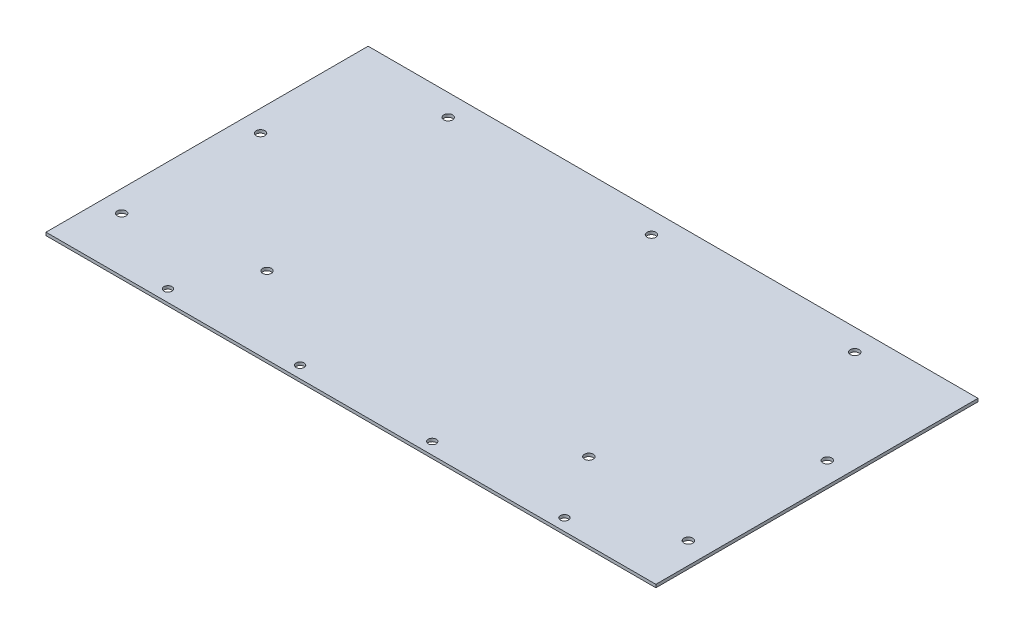
from build123d import *

# Parameters (mm, degrees)
SKETCH1_W            = 457.2
SKETCH1_H            = 2.286
BOSS_EXTRUDE1_DEPTH  = 238.315200026
SKETCH2_W            = 457.2
SKETCH2_H            = 2.286
BOSS_EXTRUDE2_DEPTH  = 3.175
SKETCH9_R            = 3
CUT_EXTRUDE10_DEPTH  = 2.54
LPATTERN1_COUNT      = 4
LPATTERN1_PITCH      = 99.06
M6_CLEARANCE_HOLE1_D = 6.6


with BuildPart() as part:
    # Sketch1 → Boss-Extrude1 (new body)
    with BuildSketch(Plane.XY):
        Rectangle(SKETCH1_W, SKETCH1_H)
    extrude(amount=BOSS_EXTRUDE1_DEPTH)

    # Sketch2 → Boss-Extrude2 (add)
    with BuildSketch(Plane(origin=(0, 0, 0), x_dir=(-1, 0, 0), z_dir=(0, 0, -1))):
        Rectangle(SKETCH2_W, SKETCH2_H)
    extrude(amount=BOSS_EXTRUDE2_DEPTH)

    # Sketch9 → Cut-Extrude10 (cut)
    with BuildSketch(Plane(origin=(0, 1.143, 0), x_dir=(1, 0, 0), z_dir=(0, 1, 0))):
        with Locations((-146.05, -229.425200026)):
            Circle(SKETCH9_R)
    cut_extrude10 = extrude(amount=-CUT_EXTRUDE10_DEPTH, mode=Mode.SUBTRACT)

    # LPattern1: Cut-Extrude10 ×4
    with Locations(*[(i * LPATTERN1_PITCH, 0, 0) for i in range(1, LPATTERN1_COUNT)]):
        add(cut_extrude10, mode=Mode.SUBTRACT)

    # M6 Clearance Hole1 (through all)
    with Locations(Plane.XZ.offset(1.143)):
        with Locations((-212.419, 93.644793717), (-152.4, 13.0175), (0, 13.0175), (152.4, 13.0175), (212.419, 93.644793717), (212.419, 197.784793717), (120.65, 180.586), (-120.65, 180.586), (-212.419, 197.784793717)):
            Hole(M6_CLEARANCE_HOLE1_D / 2)


solid = part.part
